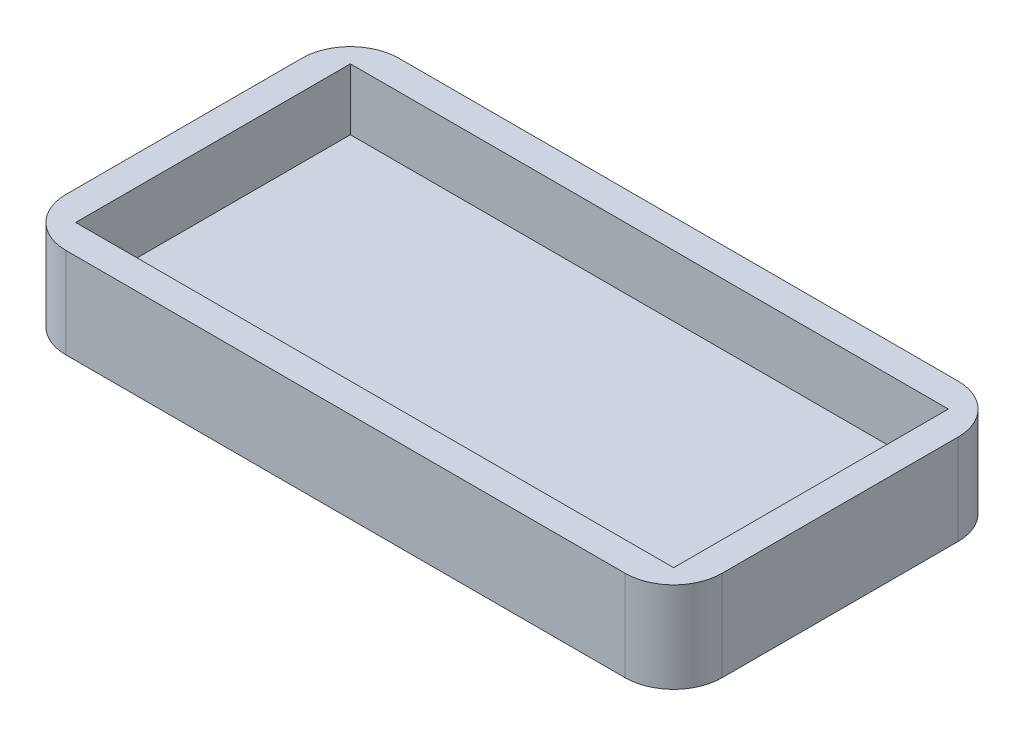
from build123d import *

# Parameters (mm, degrees)
CROQUIS1_W              = 37
CROQUIS1_H              = 17
SALIENTE_EXTRUIR1_DEPTH = 3.8
VACIADO1_T              = 1.8
REDONDEO2_R             = 3


with BuildPart() as part:
    # Croquis1 → Saliente-Extruir1 (new body)
    with BuildSketch(Plane(origin=(0, 0, 0), x_dir=(1, 0, 0), z_dir=(0, 1, 0))):
        Rectangle(CROQUIS1_W, CROQUIS1_H)
    extrude(amount=SALIENTE_EXTRUIR1_DEPTH)

    # Vaciado1
    vaciado1_openings = [part.faces().sort_by_distance(p)[0] for p in [
        (0, 3.8, 0),
    ]]
    offset(amount=VACIADO1_T, openings=vaciado1_openings, kind=Kind.INTERSECTION)

    # Redondeo2
    # the kernel refuses this fillet: 3 mm, written as the material it takes off along each edge
    with BuildSketch(Plane(origin=(20.3, -9.3, 10.3), x_dir=(-1, 0, 0), z_dir=(0, 1, 0)), Plane(origin=(-20.3, 11.3, 10.3), x_dir=(1, 0, 0), z_dir=(0, -1, 0)), Plane(origin=(-20.3, -9.3, -10.3), x_dir=(1, 0, 0), z_dir=(0, 1, 0)), Plane(origin=(20.3, -9.3, -10.3), x_dir=(0, 0, 1), z_dir=(0, 1, 0))) as redondeo2_piece_1:
        with BuildLine():
            CenterArc((REDONDEO2_R, -REDONDEO2_R), REDONDEO2_R, 90, 90)
            Line((0, -REDONDEO2_R), (0, 0))
            Line((0, 0), (REDONDEO2_R, 0))
        make_face()
    extrude(amount=20.6, mode=Mode.SUBTRACT)


solid = part.part
